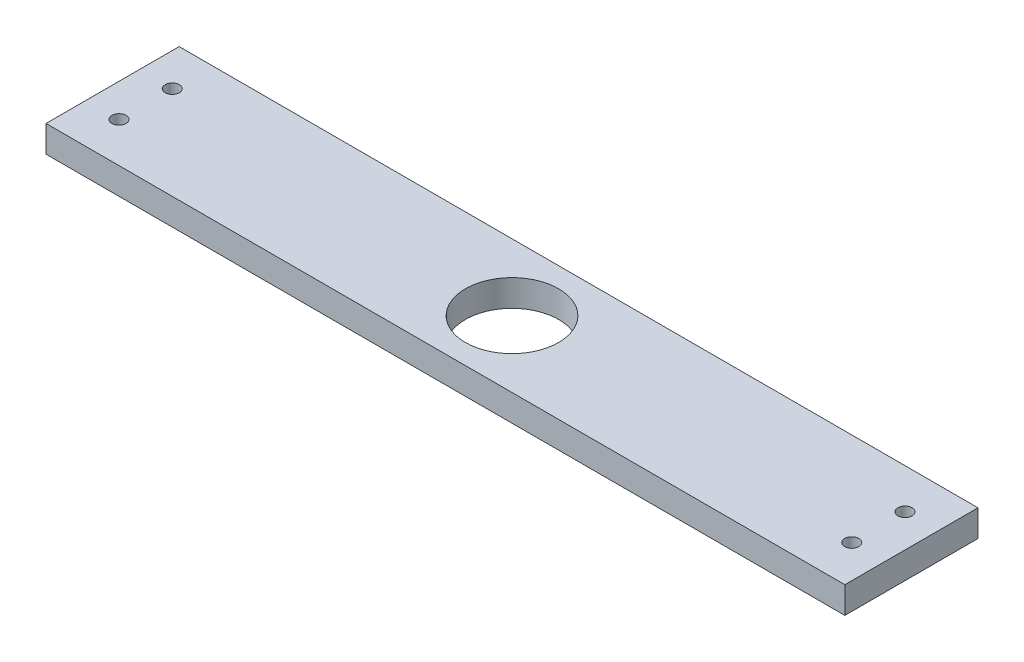
from build123d import *

# Parameters (mm, degrees)
SKETCH1_W               = 381
SKETCH1_H               = 63.5
BOSS_EXTRUDE1_DEPTH     = 12.7
SKETCH2_R               = 22.225
CUT_EXTRUDE1_DEPTH      = 194.544833307
F_1_4_CLEARANCE_HOLE1_D = 6.7564


with BuildPart() as part:
    # Sketch1 → Boss-Extrude1 (new body)
    with BuildSketch(Plane(origin=(0, 0, 0), x_dir=(1, 0, 0), z_dir=(0, 1, 0))):
        Rectangle(SKETCH1_W, SKETCH1_H)
    extrude(amount=BOSS_EXTRUDE1_DEPTH)

    # Sketch2 → Cut-Extrude1 (cut, through all)
    with BuildSketch(Plane(origin=(0, 12.7, 0), x_dir=(1, 0, 0), z_dir=(0, 1, 0))):
        Circle(SKETCH2_R)
    extrude(amount=-CUT_EXTRUDE1_DEPTH, mode=Mode.SUBTRACT)

    # 1/4 Clearance Hole1 (through all)
    with Locations(Plane(origin=(0, 12.7, 0), x_dir=(1, 0, 0), z_dir=(0, 1, 0))):
        with Locations((-174.738781322, 12.7), (174.738781322, 12.7), (-174.738781322, -12.7), (174.738781322, -12.7)):
            Hole(F_1_4_CLEARANCE_HOLE1_D / 2)


solid = part.part
